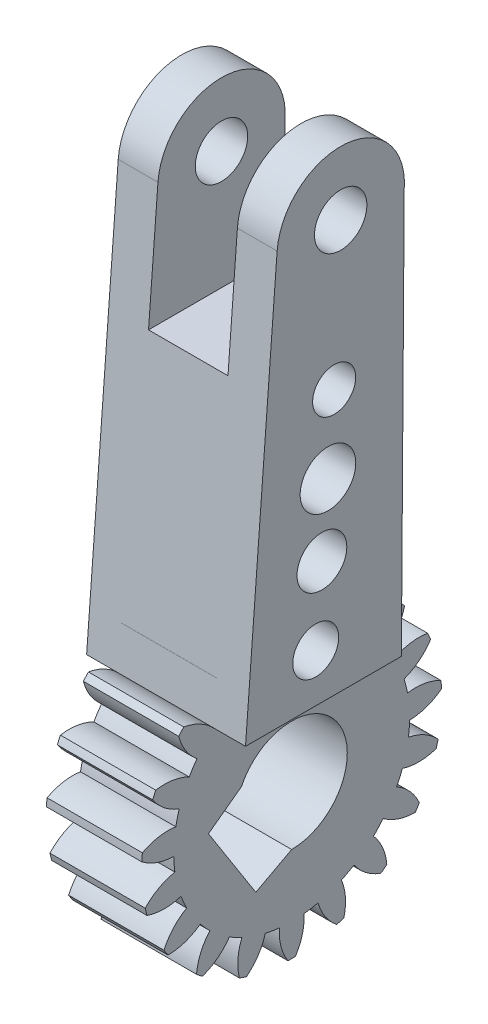
from build123d import *

# Parameters (mm, degrees)
SPUR_START             = -32.726855157
SPUR_GEAR_GB_OUTLINE_R = 22.5
SPUR_GEAR_GB_DEPTH     = 75
SKETCH_2_R             = 56.152658256
CUT_EXTRUDE_1_DEPTH    = 45
EXTRUDE_1_DEPTH        = 30
EXTRUDE_START          = -30
SKETCH_5_R             = 22.5
EXTRUDE_2_DEPTH        = 30
SCALE_1_SCALE          = 0.2
CUT_EXTRUDE_3_DEPTH    = 10
EXTRUDE_3_DEPTH        = 5
SKETCH_8_R             = 1.65
CUT_EXTRUDE_4_DEPTH    = 10
SKETCH_9_W             = 18.454746183
SKETCH_9_H             = 13.449677925
CUT_EXTRUDE_5_DEPTH    = 2.5
SKETCH_10_R            = 1.446114005
SKETCH_10_R_2          = 1.567494057
SKETCH_10_R_3          = 1.749983797
SKETCH_10_R_4          = 1.35600832
CUT_EXTRUDE_6_DEPTH    = 80.014451116


# Read off the part's stored shape, not the designer's step: spur gear_gb
with BuildPart() as part:
    # spur gear_gb outline → spur gear_gb (new body)
    with BuildSketch(Plane.YZ.offset(SPUR_START)):
        with BuildLine():
            ThreePointArc((32.862431273, 33.858374177), (32.001554259, 34.671025411), (31.120587981, 35.461853886))
            ThreePointArc((31.120587981, 35.461853886), (26.170323532, 33.302671085), (22.140322459, 29.707357493))
            ThreePointArc((22.140322459, 29.707357493), (20.304903422, 30.987038971), (18.395725829, 32.153824573))
            ThreePointArc((18.395725829, 32.153824573), (20.069385125, 37.288613083), (20.058208562, 42.689267077))
            ThreePointArc((20.058208562, 42.689267077), (18.980108815, 43.178360316), (17.890094133, 43.64029024))
            ThreePointArc((17.890094133, 43.64029024), (13.909134176, 39.99074968), (11.264886092, 35.281700885))
            ThreePointArc((11.264886092, 35.281700885), (9.113403224, 35.896086104), (6.928815473, 36.379743093))
            ThreePointArc((6.928815473, 36.379743093), (6.844528189, 41.779750883), (5.080367717, 46.884153523))
            ThreePointArc((5.080367717, 46.884153523), (3.901874073, 46.996687926), (2.720930993, 47.079662024))
            ThreePointArc((2.720930993, 47.079662024), (0.14067431, 42.335248053), (-0.831275476, 37.022762562))
            ThreePointArc((-0.831275476, 37.022762562), (-3.065675621, 36.90527335), (-5.28893955, 36.653389986))
            ThreePointArc((-5.28893955, 36.653389986), (-7.12203958, 41.733442422), (-10.448009799, 45.988452479))
            ThreePointArc((-10.448009799, 45.988452479), (-11.599189267, 45.712233197), (-12.74308724, 45.407259939))
            ThreePointArc((-12.74308724, 45.407259939), (-13.643029801, 40.082103428), (-12.837355447, 34.741871474))
            ThreePointArc((-12.837355447, 34.741871474), (-14.912540945, 33.90523961), (-16.933555907, 32.945111364))
            ThreePointArc((-16.933555907, 32.945111364), (-20.316823851, 37.154705941), (-24.844183336, 40.099227051))
            ThreePointArc((-24.844183336, 40.099227051), (-25.843300471, 39.464186729), (-26.826194241, 38.804314699))
            ThreePointArc((-26.826194241, 38.804314699), (-25.948299939, 33.475478984), (-23.452308764, 28.686197563))
            ThreePointArc((-23.452308764, 28.686197563), (-25.143401065, 27.221085091), (-26.74315873, 25.656756756))
            ThreePointArc((-26.74315873, 25.656756756), (-31.309965009, 28.539718582), (-36.548104111, 29.854666195))
            ThreePointArc((-36.548104111, 29.854666195), (-37.286889069, 28.929621306), (-38.002266845, 27.986357877))
            ThreePointArc((-38.002266845, 27.986357877), (-35.44166915, 23.231304993), (-31.525840525, 19.51196706))
            ThreePointArc((-31.525840525, 19.51196706), (-32.64958354, 17.577141651), (-33.654725342, 15.578132475))
            ThreePointArc((-33.654725342, 15.578132475), (-38.910185635, 16.822047902), (-44.291470704, 16.364927041))
            ThreePointArc((-44.291470704, 16.364927041), (-44.68986467, 15.250120552), (-45.060204171, 14.125682952))
            ThreePointArc((-45.060204171, 14.125682952), (-41.094383574, 10.459696662), (-36.183058293, 8.213350193))
            ThreePointArc((-36.183058293, 8.213350193), (-36.617677028, 6.018480201), (-36.919280256, 3.801413847))
            ThreePointArc((-36.919280256, 3.801413847), (-42.293883893, 3.271485337), (-47.235169193, 1.091832139))
            ThreePointArc((-47.235169193, 1.091832139), (-47.25, -0.091929368), (-47.235169193, -1.275690876))
            ThreePointArc((-47.235169193, -1.275690876), (-42.293883893, -3.455344074), (-36.919280256, -3.985272584))
            ThreePointArc((-36.919280256, -3.985272584), (-36.617677028, -6.202338938), (-36.183058293, -8.39720893))
            ThreePointArc((-36.183058293, -8.39720893), (-41.094383574, -10.643555399), (-45.060204171, -14.309541689))
            ThreePointArc((-45.060204171, -14.309541689), (-44.68986467, -15.433979288), (-44.291470704, -16.548785777))
            ThreePointArc((-44.291470704, -16.548785777), (-38.910185635, -17.005906639), (-33.654725342, -15.761991212))
            ThreePointArc((-33.654725342, -15.761991212), (-32.64958354, -17.761000388), (-31.525840525, -19.695825796))
            ThreePointArc((-31.525840525, -19.695825796), (-35.44166915, -23.41516373), (-38.002266845, -28.170216613))
            ThreePointArc((-38.002266845, -28.170216613), (-37.286889069, -29.113480043), (-36.548104111, -30.038524932))
            ThreePointArc((-36.548104111, -30.038524932), (-31.309965009, -28.723577319), (-26.74315873, -25.840615493))
            ThreePointArc((-26.74315873, -25.840615493), (-25.143401065, -27.404943828), (-23.452308764, -28.870056299))
            ThreePointArc((-23.452308764, -28.870056299), (-25.948299939, -33.65933772), (-26.826194241, -38.988173435))
            ThreePointArc((-26.826194241, -38.988173435), (-25.843300471, -39.648045466), (-24.844183336, -40.283085788))
            ThreePointArc((-24.844183336, -40.283085788), (-20.316823851, -37.338564677), (-16.933555907, -33.128970101))
            ThreePointArc((-16.933555907, -33.128970101), (-14.912540945, -34.089098347), (-12.837355447, -34.925730211))
            ThreePointArc((-12.837355447, -34.925730211), (-13.643029801, -40.265962164), (-12.74308724, -45.591118675))
            ThreePointArc((-12.74308724, -45.591118675), (-11.599189267, -45.896091934), (-10.448009799, -46.172311216))
            ThreePointArc((-10.448009799, -46.172311216), (-7.12203958, -41.917301159), (-5.28893955, -36.837248723))
            ThreePointArc((-5.28893955, -36.837248723), (-3.065675621, -37.089132087), (-0.831275476, -37.206621299))
            ThreePointArc((-0.831275476, -37.206621299), (0.14067431, -42.51910679), (2.720930993, -47.263520761))
            ThreePointArc((2.720930993, -47.263520761), (3.901874073, -47.180546663), (5.080367717, -47.06801226))
            ThreePointArc((5.080367717, -47.06801226), (6.844528189, -41.96360962), (6.928815473, -36.56360183))
            ThreePointArc((6.928815473, -36.56360183), (9.113403224, -36.079944841), (11.264886092, -35.465559622))
            ThreePointArc((11.264886092, -35.465559622), (13.909134176, -40.174608417), (17.890094133, -43.824148977))
            ThreePointArc((17.890094133, -43.824148977), (18.980108815, -43.362219053), (20.058208562, -42.873125814))
            ThreePointArc((20.058208562, -42.873125814), (20.069385125, -37.47247182), (18.395725829, -32.33768331))
            ThreePointArc((18.395725829, -32.33768331), (20.304903422, -31.170897707), (22.140322459, -29.891216229))
            ThreePointArc((22.140322459, -29.891216229), (26.170323532, -33.486529822), (31.120587981, -35.645712623))
            ThreePointArc((31.120587981, -35.645712623), (32.001554259, -34.854884148), (32.862431273, -34.042232914))
            ThreePointArc((32.862431273, -34.042232914), (31.119412774, -28.930572226), (27.869173851, -24.617437006))
            ThreePointArc((27.869173851, -24.617437006), (29.296052271, -22.893962115), (30.616511345, -21.087657722))
            ThreePointArc((30.616511345, -21.087657722), (35.595552259, -23.179628097), (40.978683235, -23.614472179))
            ThreePointArc((40.978683235, -23.614472179), (41.555134745, -22.58044369), (42.105499643, -21.532297832))
            ThreePointArc((42.105499643, -21.532297832), (38.797169181, -17.2635582), (34.322564452, -14.239471396))
            ThreePointArc((34.322564452, -14.239471396), (35.112519281, -12.146072463), (35.774926162, -10.008886264))
            ThreePointArc((35.774926162, -10.008886264), (41.163450577, -10.370815972), (46.396102311, -9.034199232))
            ThreePointArc((46.396102311, -9.034199232), (46.605571586, -7.869023759), (46.785783792, -6.698966145))
            ThreePointArc((46.785783792, -6.698966145), (42.270650308, -3.735731746), (37.056572625, -2.328400087))
            ThreePointArc((37.056572625, -2.328400087), (37.124, -0.091929368), (37.056572625, 2.14454135))
            ThreePointArc((37.056572625, 2.14454135), (42.270650308, 3.551873009), (46.785783792, 6.515107408))
            ThreePointArc((46.785783792, 6.515107408), (46.605571586, 7.685165023), (46.396102311, 8.850340496))
            ThreePointArc((46.396102311, 8.850340496), (41.163450577, 10.186957235), (35.774926162, 9.825027527))
            ThreePointArc((35.774926162, 9.825027527), (35.112519281, 11.962213726), (34.322564452, 14.05561266))
            ThreePointArc((34.322564452, 14.05561266), (38.797169181, 17.079699464), (42.105499643, 21.348439095))
            ThreePointArc((42.105499643, 21.348439095), (41.555134745, 22.396584953), (40.978683235, 23.430613443))
            ThreePointArc((40.978683235, 23.430613443), (35.595552259, 22.99576936), (30.616511345, 20.903798985))
            ThreePointArc((30.616511345, 20.903798985), (29.296052271, 22.710103378), (27.869173851, 24.433578269))
            ThreePointArc((27.869173851, 24.433578269), (31.119412774, 28.746713489), (32.862431273, 33.858374177))
        make_face()
        with Locations((0, -0.091929368)):
            Circle(SPUR_GEAR_GB_OUTLINE_R, mode=Mode.SUBTRACT)
    extrude(amount=SPUR_GEAR_GB_DEPTH)

    # 草图2 → 切除-拉伸1 (cut)
    with BuildSketch(Plane.ZY.offset(32.726855157)):
        with Locations((-0.091929368, 0)):
            Circle(SKETCH_2_R)
    extrude(amount=-CUT_EXTRUDE_1_DEPTH, mode=Mode.SUBTRACT)

    # 草图4 → 凸台-拉伸1 (add)
    with BuildSketch(Plane(origin=(42.273144843, 0, 0), x_dir=(0, 0, -1), z_dir=(1, 0, 0))):
        with BuildLine():
            Line((-24.433578269, 27.869173851), (-23.430613443, 40.978683235))
            Line((-23.430613443, 40.978683235), (-14.487711984, 157.869173851))
            ThreePointArc((-14.487711984, 157.869173851), (7.042421291, 176.339040577), (25.512288016, 154.808907302))
            Line((25.512288016, 154.808907302), (24.617437006, 27.869173851))
            Line((24.617437006, 27.869173851), (-24.433578269, 27.869173851))
        make_face()
    extrude(amount=-EXTRUDE_1_DEPTH)

    # 草图5 → 凸台-拉伸2 (add)
    with BuildSketch(Plane(origin=(42.273144843, 0, 0), x_dir=(0, 0, -1), z_dir=(1, 0, 0)).offset(EXTRUDE_START)):
        with Locations((0.091929368, 0)):
            Circle(SKETCH_5_R)
    extrude(amount=EXTRUDE_2_DEPTH)


with BuildPart() as part_1:
    # 缩放比例1: scaled about (27.273144843, 52.936955481, -1.705643422)
    add(part.part.scale(SCALE_1_SCALE).moved(Location((21.818515874, 42.349564385, -1.364514738))))

    # 草图6 → 切除-拉伸3 (cut)
    with BuildSketch(Plane(origin=(30.273144843, 0, 0), x_dir=(0, 0, -1), z_dir=(1, 0, 0))):
        with BuildLine():
            Line((-0.872032296, 37.645512175), (-3.855195053, 42.325601914))
            Line((-3.855195053, 42.325601914), (-1.776224322, 43.856192956))
            ThreePointArc((-1.776224322, 43.856192956), (4.342900611, 44.217290275), (1.382900611, 38.849564385))
            Line((1.382900611, 38.849564385), (-0.872032296, 37.645512175))
        make_face()
    extrude(amount=-CUT_EXTRUDE_3_DEPTH, mode=Mode.SUBTRACT)

    # 草图7 → 凸台-拉伸3 (add, symmetric)
    with BuildSketch(Plane(origin=(27.273144843, 0, 0), x_dir=(0, 0, -1), z_dir=(1, 0, 0))):
        with BuildLine():
            Line((6.288002139, 47.923399155), (6.466972341, 73.311345845))
            ThreePointArc((6.466972341, 73.311345845), (2.772998996, 77.6173725), (-1.533027659, 73.923399155))
            Line((-1.533027659, 73.923399155), (-3.321607951, 50.545301032))
            Line((-3.321607951, 50.545301032), (-3.322451181, 50.53427937))
            Line((-3.322451181, 50.53427937), (-3.522200916, 47.923399155))
            Line((-3.522200916, 47.923399155), (6.288002139, 47.923399155))
        make_face()
    extrude(amount=EXTRUDE_3_DEPTH, both=True)

    # 草图8 → 切除-拉伸4 (cut)
    with BuildSketch(Plane(origin=(32.273144843, 0, 0), x_dir=(0, 0, -1), z_dir=(1, 0, 0))):
        with Locations((2.466972341, 73.6173725)):
            Circle(SKETCH_8_R)
    extrude(amount=-CUT_EXTRUDE_4_DEPTH, mode=Mode.SUBTRACT)

    # 草图9 → 切除-拉伸5 (cut, symmetric)
    with BuildSketch(Plane(origin=(27.273144843, 0, 0), x_dir=(0, 0, -1), z_dir=(1, 0, 0))):
        with Locations((1.880211444, 72.900415106)):
            Rectangle(SKETCH_9_W, SKETCH_9_H)
    extrude(amount=CUT_EXTRUDE_5_DEPTH, both=True, mode=Mode.SUBTRACT)

    # 草图10 → 切除-拉伸6 (cut, through all)
    with BuildSketch(Plane(origin=(32.273144843, 0, 0), x_dir=(0, 0, -1), z_dir=(1, 0, 0))):
        with Locations((0.89588905, 50.944816989)):
            Circle(SKETCH_10_R)
        with Locations((1.285013172, 55.613074907)):
            Circle(SKETCH_10_R_2)
        with Locations((1.667330314, 59.914483987)):
            Circle(SKETCH_10_R_3)
        with Locations((2.056454436, 64.582741905)):
            Circle(SKETCH_10_R_4)
    extrude(amount=-CUT_EXTRUDE_6_DEPTH, mode=Mode.SUBTRACT)


solid = part_1.part
